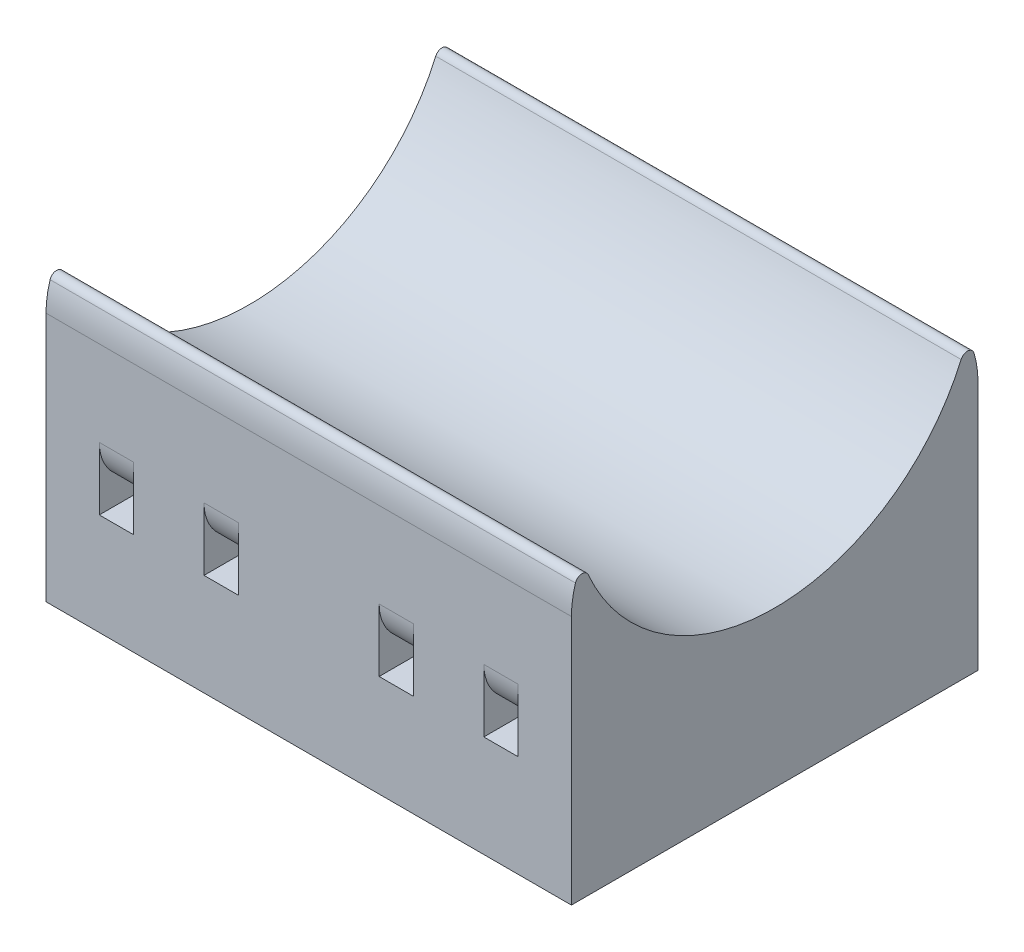
from build123d import *

# Parameters (mm, degrees)
SKETCH2_W           = 46
SKETCH2_H           = 35.6
BOSS_EXTRUDE1_DEPTH = 32
CUT_EXTRUDE2_REACH  = 60.795
CUT_EXTRUDE3_REACH  = 51.55
SKETCH4_W           = 3
SKETCH4_H           = 1.5
FILLET1_R           = 4
FILLET2_R           = 8
FILLET3_R           = 0.6


with BuildPart() as part:
    # Sketch2 → Boss-Extrude1 (new body)
    with BuildSketch(Plane(origin=(0, 0, 0), x_dir=(1, 0, 0), z_dir=(0, 1, 0))):
        Rectangle(SKETCH2_W, SKETCH2_H)
    extrude(amount=BOSS_EXTRUDE1_DEPTH)

    # Sketch3 → Cut-Extrude2 (cut, up to next)
    with BuildSketch(Plane(origin=(23, 0, 0), x_dir=(0, 0, -1), z_dir=(1, 0, 0)), mode=Mode.PRIVATE) as cut_extrude2_sk1:
        with BuildLine():
            Line((-17.8, 25.6678015), (-16.849429134, 25.6678015))
            ThreePointArc((-16.849429134, 25.6678015), (0, 13.625659234), (16.849429134, 25.6678015))
            Line((16.849429134, 25.6678015), (17.8, 25.6678015))
            Line((17.8, 25.6678015), (17.8, 32))
            Line((17.8, 32), (-17.8, 32))
            Line((-17.8, 32), (-17.8, 25.6678015))
        make_face()
    cut_extrude2_tool1 = extrude(cut_extrude2_sk1.sketch, amount=-CUT_EXTRUDE2_REACH, mode=Mode.PRIVATE) & part.part
    add(cut_extrude2_tool1.solids().sort_by_distance((23, 24.200301, 0))[0], mode=Mode.SUBTRACT)

    # Sketch4 → Cut-Extrude3 (cut, up to next)
    with BuildSketch(Plane(origin=(0, 0, -17.8), x_dir=(-1, 0, 0), z_dir=(0, 0, -1)), mode=Mode.PRIVATE) as cut_extrude3_sk1:
        with Locations((-16.833333333, 9.6678015)):
            Rectangle(SKETCH4_W, SKETCH4_H)
    cut_extrude3_tool1 = extrude(cut_extrude3_sk1.sketch, amount=-CUT_EXTRUDE3_REACH, mode=Mode.PRIVATE) & part.part
    # Sketch4 → Cut-Extrude3 (cut, up to next)
    with BuildSketch(Plane(origin=(0, 0, -17.8), x_dir=(-1, 0, 0), z_dir=(0, 0, -1)), mode=Mode.PRIVATE) as cut_extrude3_sk2:
        with Locations((-7.666666667, 9.6678015)):
            Rectangle(SKETCH4_W, SKETCH4_H)
    cut_extrude3_tool2 = extrude(cut_extrude3_sk2.sketch, amount=-CUT_EXTRUDE3_REACH, mode=Mode.PRIVATE) & part.part
    # Sketch4 → Cut-Extrude3 (cut, up to next)
    with BuildSketch(Plane(origin=(0, 0, -17.8), x_dir=(-1, 0, 0), z_dir=(0, 0, -1)), mode=Mode.PRIVATE) as cut_extrude3_sk3:
        with Locations((7.666666667, 9.6678015)):
            Rectangle(SKETCH4_W, SKETCH4_H)
    cut_extrude3_tool3 = extrude(cut_extrude3_sk3.sketch, amount=-CUT_EXTRUDE3_REACH, mode=Mode.PRIVATE) & part.part
    # Sketch4 → Cut-Extrude3 (cut, up to next)
    with BuildSketch(Plane(origin=(0, 0, -17.8), x_dir=(-1, 0, 0), z_dir=(0, 0, -1)), mode=Mode.PRIVATE) as cut_extrude3_sk4:
        with Locations((16.833333333, 9.6678015)):
            Rectangle(SKETCH4_W, SKETCH4_H)
    cut_extrude3_tool4 = extrude(cut_extrude3_sk4.sketch, amount=-CUT_EXTRUDE3_REACH, mode=Mode.PRIVATE) & part.part
    add(cut_extrude3_tool1.solids().sort_by_distance((16.833333, 9.667801, -17.8))[0], mode=Mode.SUBTRACT)
    add(cut_extrude3_tool2.solids().sort_by_distance((7.666667, 9.667801, -17.8))[0], mode=Mode.SUBTRACT)
    add(cut_extrude3_tool3.solids().sort_by_distance((-7.666667, 9.667801, -17.8))[0], mode=Mode.SUBTRACT)
    add(cut_extrude3_tool4.solids().sort_by_distance((-16.833333, 9.667801, -17.8))[0], mode=Mode.SUBTRACT)

    # Fillet1
    fillet1_edges = [part.edges().sort_by_distance(p)[0] for p in [
        (16.833333333, 10.4178015, -17.8),
        (16.833333333, 10.4178015, 17.8),
        (7.666666667, 10.4178015, -17.8),
        (7.666666667, 10.4178015, 17.8),
        (-7.666666667, 10.4178015, -17.8),
        (-7.666666667, 10.4178015, 17.8),
        (-16.833333333, 10.4178015, -17.8),
        (-16.833333333, 10.4178015, 17.8),
    ]]
    fillet(fillet1_edges, radius=FILLET1_R)

    # Fillet2
    # the kernel refuses this fillet: 8 mm, written as the material it takes off along each edge
    with BuildSketch(Plane(origin=(32.455669225, 25.6678015, 17.8), x_dir=(0, -1, 0), z_dir=(-1, 0, 0))) as fillet2_piece_1:
        with BuildLine():
            CenterArc((3.78226769, -8), FILLET2_R, 90, 28.215129255)
            Line((0, -0.950570866), (-0.075645354, -0.809582283))
            ThreePointArc((-0.075645354, -0.809582283), (-0.16, -0.475285433), (-0.16, 0))
            Line((-0.16, 0), (0, 0.16))
            Line((0, 0.16), (3.78226769, 0.16))
            Line((3.78226769, 0.16), (3.78226769, 0))
        make_face()
    extrude(amount=64.91133845, mode=Mode.SUBTRACT)
    with BuildSketch(Plane(origin=(32.455669225, 25.6678015, -17.8), x_dir=(0, -1, 0), z_dir=(-1, 0, 0))) as fillet2_piece_2:
        with BuildLine():
            CenterArc((3.78226769, 8), FILLET2_R, 241.784870745, 28.215129255)
            Line((0, 0.950570866), (-0.075645354, 0.809582283))
            ThreePointArc((-0.075645354, 0.809582283), (-0.16, 0.475285433), (-0.16, 0))
            Line((-0.16, 0), (0, -0.16))
            Line((0, -0.16), (3.78226769, -0.16))
            Line((3.78226769, -0.16), (3.78226769, 0))
        make_face()
    extrude(amount=64.91133845, mode=Mode.SUBTRACT)

    # Fillet3
    fillet3_edges = [part.edges().sort_by_distance(p)[0] for p in [
        (0, 25.6678015, -16.849429134),
        (0, 25.6678015, 16.849429134),
    ]]
    fillet(fillet3_edges, radius=FILLET3_R)


solid = part.part
